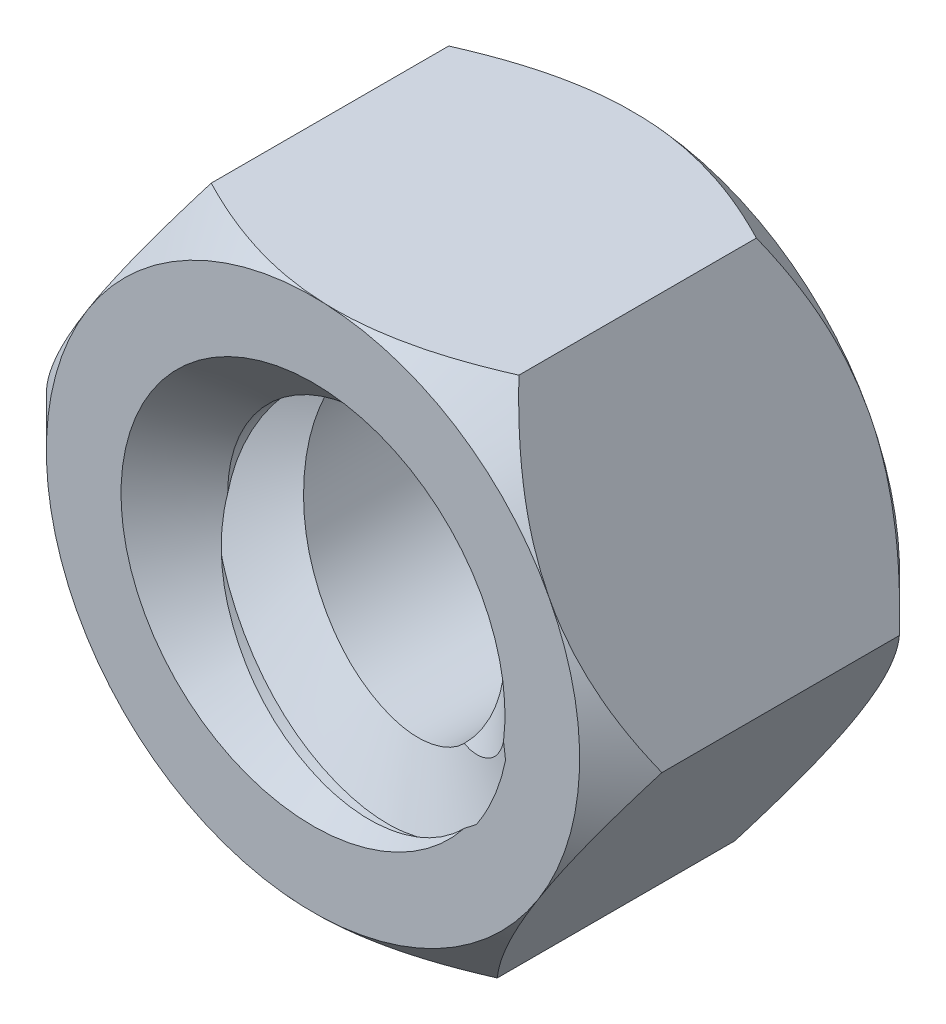
from build123d import *

# Parameters (mm, degrees)
BOSS_EXTRUDE1_DEPTH     = 1.5
SKETCH2_OUTSIDE_W       = 21.19
SKETCH2_OUTSIDE_H       = 20.534
SKETCH2_OUTSIDE_R       = 2.5
CUT_EXTRUDE1_DEPTH      = 5.884168025
CUT_EXTRUDE1_DRAFT      = -45
MIRROR1_COPY_1_SKETCH_W = 21.19
MIRROR1_COPY_1_SKETCH_H = 20.534
MIRROR1_COPY_1_SKETCH_R = 2.5
MIRROR1_COPY_1_DEPTH    = 5.884168025
MIRROR1_COPY_1_DRAFT    = -45
SKETCH3_R               = 1.3
CUT_EXTRUDE2_DEPTH      = 5.884168025
CHAMFER1_SIZE           = 0.5
THREAD1_PITCH           = 2
SCALE1_SCALE            = 0.8


with BuildPart() as part:
    # Sketch1 → Boss-Extrude1 (new, symmetric)
    with BuildSketch(Plane.XY):
        Polygon((1.340849076, -2.556454007), (2.884378651, -0.117017641), (1.543529576, 2.439436366), (-1.340849076, 2.556454007), (-2.884378651, 0.117017641), (-1.543529576, -2.439436366), align=None)
    extrude(amount=BOSS_EXTRUDE1_DEPTH, both=True)


with BuildPart() as cut_extrude1_tool:
    # Sketch2 outside → Cut-Extrude1 (with draft: the straight prism first)
    with BuildSketch(Plane.XY.offset(1.5)):
        Rectangle(SKETCH2_OUTSIDE_W, SKETCH2_OUTSIDE_H)
        Circle(SKETCH2_OUTSIDE_R, mode=Mode.SUBTRACT)
    extrude(amount=-CUT_EXTRUDE1_DEPTH)
    # Cut-Extrude1: the draft: its side faces are tilted about the plane it starts from
    cut_extrude1_sides = [cut_extrude1_tool.faces().sort_by_distance(p)[0] for p in [
        (0, -10.267, -1.442084012),
        (10.595, 0, -1.442084012),
        (0, 10.267, -1.442084012),
        (-10.595, 0, -1.442084012),
        (-2.5, 0, -1.442084012),
    ]]
    draft(cut_extrude1_sides, Plane.XY.offset(1.5), CUT_EXTRUDE1_DRAFT)


with BuildPart() as part_1:
    add(part.part)

    # Cut-Extrude1: cut by cut_extrude1_tool
    add(cut_extrude1_tool.part, mode=Mode.SUBTRACT)


with BuildPart() as mirror1_copy_1_tool:
    # Mirror1 copy 1 sketch → Mirror1 copy 1 (with draft: the straight prism first)
    with BuildSketch(Plane(origin=(0, 0, -1.5), x_dir=(1, 0, 0), z_dir=(0, 0, -1))):
        Rectangle(MIRROR1_COPY_1_SKETCH_W, MIRROR1_COPY_1_SKETCH_H)
        Circle(MIRROR1_COPY_1_SKETCH_R, mode=Mode.SUBTRACT)
    extrude(amount=-MIRROR1_COPY_1_DEPTH)
    # Mirror1 copy 1: the draft: its side faces are tilted about the plane it starts from
    mirror1_copy_1_sides = [mirror1_copy_1_tool.faces().sort_by_distance(p)[0] for p in [
        (0, -10.267, 1.442084012),
        (10.595, 0, 1.442084012),
        (0, 10.267, 1.442084012),
        (-10.595, 0, 1.442084012),
        (-2.5, 0, 1.442084012),
    ]]
    draft(mirror1_copy_1_sides, Plane(origin=(0, 0, -1.5), x_dir=(1, 0, 0), z_dir=(0, 0, -1)), MIRROR1_COPY_1_DRAFT)


with BuildPart() as part_2:
    add(part_1.part)

    # Mirror1 copy 1: cut by mirror1_copy_1_tool
    add(mirror1_copy_1_tool.part, mode=Mode.SUBTRACT)

    # Sketch3 → Cut-Extrude2 (cut, through all)
    with BuildSketch(Plane.XY.offset(1.5)):
        Circle(SKETCH3_R)
    extrude(amount=-CUT_EXTRUDE2_DEPTH, mode=Mode.SUBTRACT)

    # Chamfer1
    chamfer1_edges = [part_2.edges().sort_by_distance(p)[0] for p in [
        (-1.3, 0, -1.5),
        (-1.3, 0, 1.5),
    ]]
    chamfer(chamfer1_edges, length=CHAMFER1_SIZE)

    # Thread1: the profile of Thread Profile1 profile screwed along a right-hand helix of 2.25 turns, 10 arcs to a turn; built about Z, then put on its axis
    thread1_z = Axis((0, 0, 0), (0, 0, 1))
    thread1_corners = [(1.2997, 0, -0.000173205), (1.841265875, 0, 0.312499999), (1.841265875, 0, 0.437499999), (1.2997, 0, 0.750173202)]
    with BuildLine(mode=Mode.PRIVATE) as thread1_profile:
        Line(thread1_corners[0], thread1_corners[1])
        Line(thread1_corners[1], thread1_corners[2])
        Line(thread1_corners[2], thread1_corners[3])
        Line(thread1_corners[3], thread1_corners[0])
    thread1_cap = Face(thread1_profile.wire())
    thread1_turn_angles = [0, 18, 36, 54, 72, 90, 108, 126, 144, 162, 180, 198, 216, 234, 252, 270, 288, 306, 324, 342, 360]
    thread1_turn_weights = [1, 0.9510565162951535, 1, 0.9510565162951535, 1, 0.9510565162951535, 1, 0.9510565162951535, 1, 0.9510565162951535, 1, 0.9510565162951535, 1, 0.9510565162951535, 1, 0.9510565162951535, 1, 0.9510565162951535, 1, 0.9510565162951535, 1]
    thread1_turn_rails = [Edge.make_bspline([Vector(p[0], p[1], 0).rotate(thread1_z, thread1_turn_angles[k]) / thread1_turn_weights[k] + Vector(0, 0, p[2] + THREAD1_PITCH * thread1_turn_angles[k] / 360) for k in range(21)], [0, 0, 0, 1, 1, 2, 2, 3, 3, 4, 4, 5, 5, 6, 6, 7, 7, 8, 8, 9, 9, 10, 10, 10], 2, thread1_turn_weights) for p in thread1_corners]
    thread1_turn_sides = [Face.make_surface_from_curves(thread1_turn_rails[p[0]], thread1_turn_rails[p[1]]) for p in [(0, 1), (1, 2), (2, 3), (3, 0)]]
    thread1_last_angles = [720, 738, 756, 774, 792, 801, 810]
    thread1_last_weights = [1, 0.9510565162951535, 1, 0.9510565162951535, 1, 0.9876883405951379, 1]
    thread1_last_rails = [Edge.make_bspline([Vector(p[0], p[1], 0).rotate(thread1_z, thread1_last_angles[k]) / thread1_last_weights[k] + Vector(0, 0, p[2] + THREAD1_PITCH * thread1_last_angles[k] / 360) for k in range(7)], [0, 0, 0, 1, 1, 2, 2, 3, 3, 3], 2, thread1_last_weights) for p in thread1_corners]
    thread1_last_sides = [Face.make_surface_from_curves(thread1_last_rails[p[0]], thread1_last_rails[p[1]]) for p in [(0, 1), (1, 2), (2, 3), (3, 0)]]
    thread1 = Plane(origin=(0, 0, 3), x_dir=(-1, 0, 0), z_dir=(0, 0, -1)) * Solid(Shell([*[p.moved(Location((0, 0, THREAD1_PITCH * i))) for i in range(2) for p in thread1_turn_sides], *thread1_last_sides, thread1_cap, thread1_cap.rotate(thread1_z, 810).moved(Location((0, 0, THREAD1_PITCH * 810 / 360)))]))
    add(thread1, mode=Mode.SUBTRACT)


with BuildPart() as part_3:
    # Scale1: scaled about (0.005317589, 0.01279736, -1.2058e-05)
    add(part_2.part.scale(SCALE1_SCALE).moved(Location((0.001063518, 0.002559472, -2.412e-06))))


solid = part_3.part
